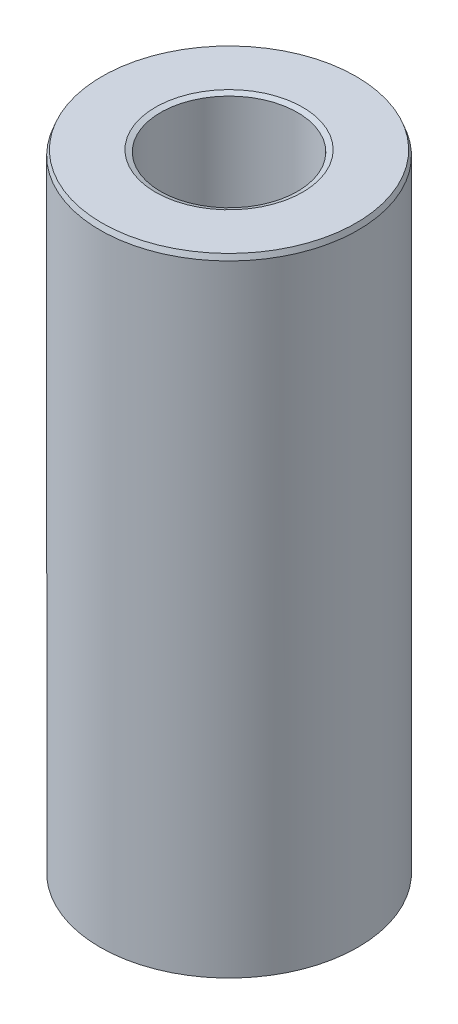
from build123d import *
from OCP.BRepFilletAPI import BRepFilletAPI_MakeChamfer

# Parameters (mm, degrees)
SKETCH1_R           = 45
BOSS_EXTRUDE1_DEPTH = 219.142361025
SKETCH2_R           = 23.880090509
CUT_EXTRUDE1_DEPTH  = 229.195912312
CHAMFER1_SIZE       = 1.807367038
CHAMFER1_SIZE2      = 0.677390466


with BuildPart() as part:
    # Sketch1 → Boss-Extrude1 (new body)
    with BuildSketch(Plane(origin=(0, 0, 0), x_dir=(1, 0, 0), z_dir=(0, 1, 0))):
        Circle(SKETCH1_R)
    extrude(amount=BOSS_EXTRUDE1_DEPTH)

    # Sketch2 → Cut-Extrude1 (cut, through all)
    with BuildSketch(Plane(origin=(0, 0, 0), x_dir=(1, 0, 0), z_dir=(0, 1, 0))):
        Circle(SKETCH2_R)
    extrude(amount=CUT_EXTRUDE1_DEPTH, mode=Mode.SUBTRACT)

    # Chamfer1: one chamfer whose edges measure the first distance from different faces: ONE call of the kernel's chamfer builder (chamfer() names one face for all edges)
    chamfer1_edges_1 = [part.edges().sort_by_distance(p)[0] for p in [
        (-23.880090509, 219.142361025, 0),
    ]]
    chamfer1_side_1 = [part.faces().sort_by_distance(p)[0] for p in [
        (-43.727207794, 219.142361025, 0),
    ]]
    chamfer1_edges_2 = [part.edges().sort_by_distance(p)[0] for p in [
        (-23.880090509, 0, 0),
    ]]
    chamfer1_side_2 = [part.faces().sort_by_distance(p)[0] for p in [
        (-23.880090509, 109.571180513, 0),
    ]]
    chamfer1_edges_3 = [part.edges().sort_by_distance(p)[0] for p in [
        (-45, 0, 0),
    ]]
    chamfer1_side_3 = [part.faces().sort_by_distance(p)[0] for p in [
        (-43.727207794, 0, 0),
    ]]
    chamfer1_edges_4 = [part.edges().sort_by_distance(p)[0] for p in [
        (-45, 219.142361025, 0),
    ]]
    chamfer1_side_4 = [part.faces().sort_by_distance(p)[0] for p in [
        (-45, 109.571180513, 0),
    ]]
    chamfer1 = BRepFilletAPI_MakeChamfer(part.part.solid().wrapped)
    for e in chamfer1_edges_1:
        chamfer1.Add(CHAMFER1_SIZE, CHAMFER1_SIZE2, e.wrapped, chamfer1_side_1[0].wrapped)  # the first distance lies on this face
    for e in chamfer1_edges_2:
        chamfer1.Add(CHAMFER1_SIZE, CHAMFER1_SIZE2, e.wrapped, chamfer1_side_2[0].wrapped)  # the first distance lies on this face
    for e in chamfer1_edges_3:
        chamfer1.Add(CHAMFER1_SIZE, CHAMFER1_SIZE2, e.wrapped, chamfer1_side_3[0].wrapped)  # the first distance lies on this face
    for e in chamfer1_edges_4:
        chamfer1.Add(CHAMFER1_SIZE, CHAMFER1_SIZE2, e.wrapped, chamfer1_side_4[0].wrapped)  # the first distance lies on this face
    add(Compound.cast(chamfer1.Shape()), mode=Mode.REPLACE)


solid = part.part
